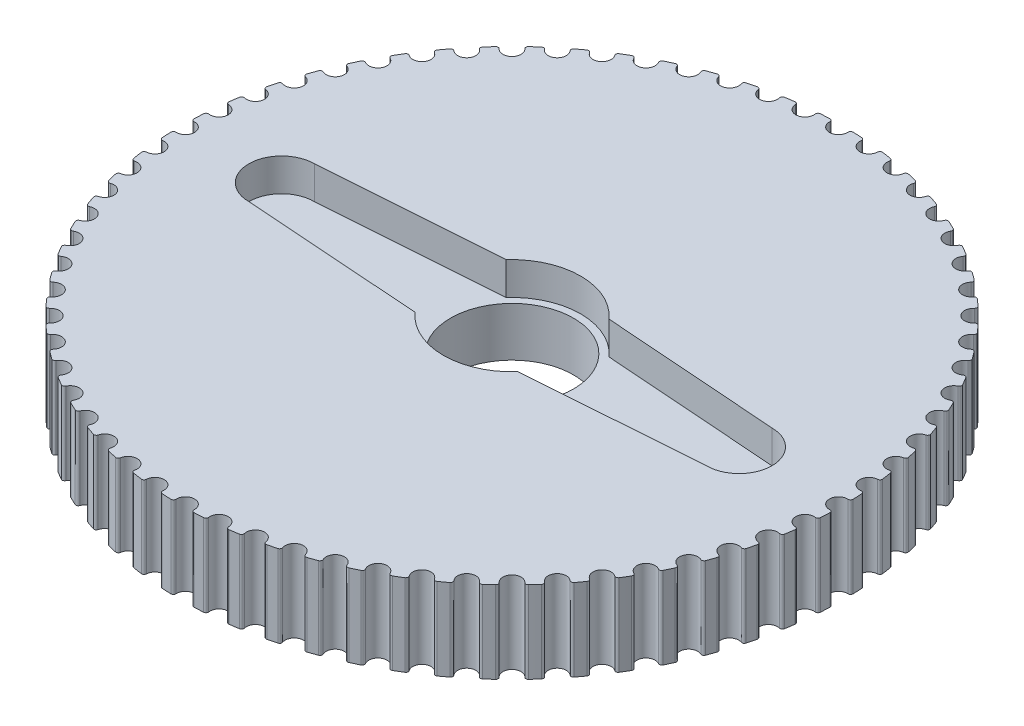
from build123d import *

# Parameters (mm, degrees)
BOSS_EXTRUDE1_DEPTH = 5
CUT_EXTRUDE2_DEPTH  = 2
SKETCH4_R           = 3.75
CUT_EXTRUDE3_DEPTH  = 3


with BuildPart() as part:
    # Sketch1 → Boss-Extrude1 (new body)
    with BuildSketch(Plane(origin=(0, 0, 0), x_dir=(1, 0, 0), z_dir=(0, 1, 0))):
        with BuildLine():
            ThreePointArc((1.264758152, 20.080208834), (0.987241607, 20.095764579), (0.709536651, 20.107485117))
            ThreePointArc((0.709536651, 20.107485117), (0.597601495, 20.063061902), (0.554407106, 19.950646841))
            ThreePointArc((0.554407106, 19.950646841), (0.40140939, 19.54173051), (0, 19.37))
            ThreePointArc((0, 19.37), (-0.40140939, 19.54173051), (-0.554407106, 19.950646841))
            ThreePointArc((-0.554407106, 19.950646841), (-0.597601495, 20.063061902), (-0.709536651, 20.107485117))
            ThreePointArc((-0.709536651, 20.107485117), (-0.987241607, 20.095764579), (-1.264758152, 20.080208834))
            ThreePointArc((-1.264758152, 20.080208834), (-1.371800073, 20.025027964), (-1.403767866, 19.908920422))
            ThreePointArc((-1.403767866, 19.908920422), (-1.515948048, 19.486976737), (-1.898592008, 19.276728156))
            ThreePointArc((-1.898592008, 19.276728156), (-2.314901036, 19.408286736), (-2.507242836, 19.800237624))
            ThreePointArc((-2.507242836, 19.800237624), (-2.561247834, 19.907877585), (-2.676998228, 19.941115327))
            ThreePointArc((-2.676998228, 19.941115327), (-2.952217146, 19.90223138), (-3.226872643, 19.859549163))
            ThreePointArc((-3.226872643, 19.859549163), (-3.327990457, 19.794142061), (-3.348423787, 19.675460217))
            ThreePointArc((-3.348423787, 19.675460217), (-3.418706077, 19.244552725), (-3.778899537, 18.997810881))
            ThreePointArc((-3.778899537, 18.997810881), (-4.206098919, 19.087930551), (-4.435932446, 19.459141295))
            ThreePointArc((-4.435932446, 19.459141295), (-4.500227957, 19.560969525), (-4.61867885, 19.582701695))
            ThreePointArc((-4.61867885, 19.582701695), (-4.88876122, 19.517028814), (-5.157910587, 19.447631177))
            ThreePointArc((-5.157910587, 19.447631177), (-5.252130474, 19.372627749), (-5.260832557, 19.252514574))
            ThreePointArc((-5.260832557, 19.252514574), (-5.288540098, 18.81679315), (-5.622814198, 18.535934303))
            ThreePointArc((-5.622814198, 18.535934303), (-6.05678977, 18.58374716), (-6.321901602, 18.930642798))
            ThreePointArc((-6.321901602, 18.930642798), (-6.395868424, 19.025678635), (-6.515879069, 19.035695941))
            ThreePointArc((-6.515879069, 19.035695941), (-6.77822385, 18.943866591), (-7.039275031, 18.848421871))
            ThreePointArc((-7.039275031, 18.848421871), (-7.125689602, 18.764544442), (-7.122576633, 18.644156691))
            ThreePointArc((-7.122576633, 18.644156691), (-7.107442587, 18.207817571), (-7.412578085, 17.895546545))
            ThreePointArc((-7.412578085, 17.895546545), (-7.849150425, 17.900592125), (-8.146987389, 18.219831862))
            ThreePointArc((-8.146987389, 18.219831862), (-8.229913182, 18.307160059), (-8.35032781, 18.305366029))
            ThreePointArc((-8.35032781, 18.305366029), (-8.60240848, 18.188264578), (-8.85284741, 18.067691959))
            ThreePointArc((-8.85284741, 18.067691959), (-8.930624445, 17.975748314), (-8.915726402, 17.856245387))
            ThreePointArc((-8.915726402, 17.856245387), (-8.857896518, 17.423490756), (-9.130954792, 17.08281489))
            ThreePointArc((-9.130954792, 17.08281489), (-9.565919471, 17.045044603), (-9.893613234, 17.333553985))
            ThreePointArc((-9.893613234, 17.333553985), (-9.984699377, 17.412333524), (-10.10435833, 17.398745436))
            ThreePointArc((-10.10435833, 17.398745436), (-10.343747213, 17.257499633), (-10.581162028, 17.112960297))
            ThreePointArc((-10.581162028, 17.112960297), (-10.649552492, 17.013835903), (-10.623012852, 16.896368679))
            ThreePointArc((-10.623012852, 16.896368679), (-10.523044063, 16.471366199), (-10.761395414, 16.10556639))
            ThreePointArc((-10.761395414, 16.10556639), (-11.190563483, 16.025343983), (-11.544958176, 16.280344508))
            ThreePointArc((-11.544958176, 16.280344508), (-11.643327459, 16.349816699), (-11.761078356, 16.324565412))
            ThreePointArc((-11.761078356, 16.324565412), (-11.985470006, 16.160535533), (-12.207574272, 15.993421473))
            ThreePointArc((-12.207574272, 15.993421473), (-12.265919528, 15.888070952), (-12.227993882, 15.773770704))
            ThreePointArc((-12.227993882, 15.773770704), (-12.086848942, 15.360613382), (-12.288197914, 14.973212482))
            ThreePointArc((-12.288197914, 14.973212482), (-12.707436251, 14.85131054), (-13.085118859, 15.070346414))
            ThreePointArc((-13.085118859, 15.070346414), (-13.189823933, 15.129842201), (-13.304532768, 15.0931709))
            ThreePointArc((-13.304532768, 15.0931709), (-13.511766172, 14.907936642), (-13.716420902, 14.719857256))
            ThreePointArc((-13.716420902, 14.719857256), (-13.764159052, 14.609295192), (-13.715212646, 14.499262694))
            ThreePointArc((-13.715212646, 14.499262694), (-13.534250858, 14.101929462), (-13.696658352, 13.696658352))
            ThreePointArc((-13.696658352, 13.696658352), (-14.101929462, 13.534250858), (-14.499262694, 13.715212646))
            ThreePointArc((-14.499262694, 13.715212646), (-14.609295192, 13.764159052), (-14.719857256, 13.716420902))
            ThreePointArc((-14.719857256, 13.716420902), (-14.907936642, 13.511766172), (-15.0931709, 13.304532768))
            ThreePointArc((-15.0931709, 13.304532768), (-15.129842201, 13.189823933), (-15.070346414, 13.085118859))
            ThreePointArc((-15.070346414, 13.085118859), (-14.85131054, 12.707436251), (-14.973212482, 12.288197914))
            ThreePointArc((-14.973212482, 12.288197914), (-15.360613382, 12.086848942), (-15.773770704, 12.227993882))
            ThreePointArc((-15.773770704, 12.227993882), (-15.888070952, 12.265919528), (-15.993421473, 12.207574272))
            ThreePointArc((-15.993421473, 12.207574272), (-16.160535533, 11.985470006), (-16.324565412, 11.761078356))
            ThreePointArc((-16.324565412, 11.761078356), (-16.349816699, 11.643327459), (-16.280344508, 11.544958176))
            ThreePointArc((-16.280344508, 11.544958176), (-16.025343983, 11.190563483), (-16.10556639, 10.761395414))
            ThreePointArc((-16.10556639, 10.761395414), (-16.471366199, 10.523044063), (-16.896368679, 10.623012852))
            ThreePointArc((-16.896368679, 10.623012852), (-17.013835903, 10.649552492), (-17.112960297, 10.581162028))
            ThreePointArc((-17.112960297, 10.581162028), (-17.257499633, 10.343747213), (-17.398745436, 10.10435833))
            ThreePointArc((-17.398745436, 10.10435833), (-17.412333524, 9.984699377), (-17.333553985, 9.893613234))
            ThreePointArc((-17.333553985, 9.893613234), (-17.045044603, 9.565919471), (-17.08281489, 9.130954792))
            ThreePointArc((-17.08281489, 9.130954792), (-17.423490756, 8.857896518), (-17.856245387, 8.915726402))
            ThreePointArc((-17.856245387, 8.915726402), (-17.975748314, 8.930624445), (-18.067691959, 8.85284741))
            ThreePointArc((-18.067691959, 8.85284741), (-18.188264578, 8.60240848), (-18.305366029, 8.35032781))
            ThreePointArc((-18.305366029, 8.35032781), (-18.307160059, 8.229913182), (-18.219831862, 8.146987389))
            ThreePointArc((-18.219831862, 8.146987389), (-17.900592125, 7.849150425), (-17.895546545, 7.412578085))
            ThreePointArc((-17.895546545, 7.412578085), (-18.207817571, 7.107442587), (-18.644156691, 7.122576633))
            ThreePointArc((-18.644156691, 7.122576633), (-18.764544442, 7.125689602), (-18.848421871, 7.039275031))
            ThreePointArc((-18.848421871, 7.039275031), (-18.943866591, 6.77822385), (-19.035695941, 6.515879069))
            ThreePointArc((-19.035695941, 6.515879069), (-19.025678635, 6.395868424), (-18.930642798, 6.321901602))
            ThreePointArc((-18.930642798, 6.321901602), (-18.58374716, 6.05678977), (-18.535934303, 5.622814198))
            ThreePointArc((-18.535934303, 5.622814198), (-18.81679315, 5.288540098), (-19.252514574, 5.260832557))
            ThreePointArc((-19.252514574, 5.260832557), (-19.372627749, 5.252130474), (-19.447631177, 5.157910587))
            ThreePointArc((-19.447631177, 5.157910587), (-19.517028814, 4.88876122), (-19.582701695, 4.61867885))
            ThreePointArc((-19.582701695, 4.61867885), (-19.560969525, 4.500227957), (-19.459141295, 4.435932446))
            ThreePointArc((-19.459141295, 4.435932446), (-19.087930551, 4.206098919), (-18.997810881, 3.778899537))
            ThreePointArc((-18.997810881, 3.778899537), (-19.244552725, 3.418706077), (-19.675460217, 3.348423787))
            ThreePointArc((-19.675460217, 3.348423787), (-19.794142061, 3.327990457), (-19.859549163, 3.226872643))
            ThreePointArc((-19.859549163, 3.226872643), (-19.90223138, 2.952217146), (-19.941115327, 2.676998228))
            ThreePointArc((-19.941115327, 2.676998228), (-19.907877585, 2.561247834), (-19.800237624, 2.507242836))
            ThreePointArc((-19.800237624, 2.507242836), (-19.408286736, 2.314901036), (-19.276728156, 1.898592008))
            ThreePointArc((-19.276728156, 1.898592008), (-19.486976737, 1.515948048), (-19.908920422, 1.403767866))
            ThreePointArc((-19.908920422, 1.403767866), (-20.025027964, 1.371800073), (-20.080208834, 1.264758152))
            ThreePointArc((-20.080208834, 1.264758152), (-20.095764579, 0.987241607), (-20.107485117, 0.709536651))
            ThreePointArc((-20.107485117, 0.709536651), (-20.063061902, 0.597601495), (-19.950646841, 0.554407106))
            ThreePointArc((-19.950646841, 0.554407106), (-19.54173051, 0.40140939), (-19.37, 0))
            ThreePointArc((-19.37, 0), (-19.54173051, -0.40140939), (-19.950646841, -0.554407106))
            ThreePointArc((-19.950646841, -0.554407106), (-20.063061902, -0.597601495), (-20.107485117, -0.709536651))
            ThreePointArc((-20.107485117, -0.709536651), (-20.095764579, -0.987241607), (-20.080208834, -1.264758152))
            ThreePointArc((-20.080208834, -1.264758152), (-20.025027964, -1.371800073), (-19.908920422, -1.403767866))
            ThreePointArc((-19.908920422, -1.403767866), (-19.486976737, -1.515948048), (-19.276728156, -1.898592008))
            ThreePointArc((-19.276728156, -1.898592008), (-19.408286736, -2.314901036), (-19.800237624, -2.507242836))
            ThreePointArc((-19.800237624, -2.507242836), (-19.907877585, -2.561247834), (-19.941115327, -2.676998228))
            ThreePointArc((-19.941115327, -2.676998228), (-19.90223138, -2.952217146), (-19.859549163, -3.226872643))
            ThreePointArc((-19.859549163, -3.226872643), (-19.794142061, -3.327990457), (-19.675460217, -3.348423787))
            ThreePointArc((-19.675460217, -3.348423787), (-19.244552725, -3.418706077), (-18.997810881, -3.778899537))
            ThreePointArc((-18.997810881, -3.778899537), (-19.087930551, -4.206098919), (-19.459141295, -4.435932446))
            ThreePointArc((-19.459141295, -4.435932446), (-19.560969525, -4.500227957), (-19.582701695, -4.61867885))
            ThreePointArc((-19.582701695, -4.61867885), (-19.517028814, -4.88876122), (-19.447631177, -5.157910587))
            ThreePointArc((-19.447631177, -5.157910587), (-19.372627749, -5.252130474), (-19.252514574, -5.260832557))
            ThreePointArc((-19.252514574, -5.260832557), (-18.81679315, -5.288540098), (-18.535934303, -5.622814198))
            ThreePointArc((-18.535934303, -5.622814198), (-18.58374716, -6.05678977), (-18.930642798, -6.321901602))
            ThreePointArc((-18.930642798, -6.321901602), (-19.025678635, -6.395868424), (-19.035695941, -6.515879069))
            ThreePointArc((-19.035695941, -6.515879069), (-18.943866591, -6.77822385), (-18.848421871, -7.039275031))
            ThreePointArc((-18.848421871, -7.039275031), (-18.764544442, -7.125689602), (-18.644156691, -7.122576633))
            ThreePointArc((-18.644156691, -7.122576633), (-18.207817571, -7.107442587), (-17.895546545, -7.412578085))
            ThreePointArc((-17.895546545, -7.412578085), (-17.900592125, -7.849150425), (-18.219831862, -8.146987389))
            ThreePointArc((-18.219831862, -8.146987389), (-18.307160059, -8.229913182), (-18.305366029, -8.35032781))
            ThreePointArc((-18.305366029, -8.35032781), (-18.188264578, -8.60240848), (-18.067691959, -8.85284741))
            ThreePointArc((-18.067691959, -8.85284741), (-17.975748314, -8.930624445), (-17.856245387, -8.915726402))
            ThreePointArc((-17.856245387, -8.915726402), (-17.423490756, -8.857896518), (-17.08281489, -9.130954792))
            ThreePointArc((-17.08281489, -9.130954792), (-17.045044603, -9.565919471), (-17.333553985, -9.893613234))
            ThreePointArc((-17.333553985, -9.893613234), (-17.412333524, -9.984699377), (-17.398745436, -10.10435833))
            ThreePointArc((-17.398745436, -10.10435833), (-17.257499633, -10.343747213), (-17.112960297, -10.581162028))
            ThreePointArc((-17.112960297, -10.581162028), (-17.013835903, -10.649552492), (-16.896368679, -10.623012852))
            ThreePointArc((-16.896368679, -10.623012852), (-16.471366199, -10.523044063), (-16.10556639, -10.761395414))
            ThreePointArc((-16.10556639, -10.761395414), (-16.025343983, -11.190563483), (-16.280344508, -11.544958176))
            ThreePointArc((-16.280344508, -11.544958176), (-16.349816699, -11.643327459), (-16.324565412, -11.761078356))
            ThreePointArc((-16.324565412, -11.761078356), (-16.160535533, -11.985470006), (-15.993421473, -12.207574272))
            ThreePointArc((-15.993421473, -12.207574272), (-15.888070952, -12.265919528), (-15.773770704, -12.227993882))
            ThreePointArc((-15.773770704, -12.227993882), (-15.360613382, -12.086848942), (-14.973212482, -12.288197914))
            ThreePointArc((-14.973212482, -12.288197914), (-14.85131054, -12.707436251), (-15.070346414, -13.085118859))
            ThreePointArc((-15.070346414, -13.085118859), (-15.129842201, -13.189823933), (-15.0931709, -13.304532768))
            ThreePointArc((-15.0931709, -13.304532768), (-14.907936642, -13.511766172), (-14.719857256, -13.716420902))
            ThreePointArc((-14.719857256, -13.716420902), (-14.609295192, -13.764159052), (-14.499262694, -13.715212646))
            ThreePointArc((-14.499262694, -13.715212646), (-14.101929462, -13.534250858), (-13.696658352, -13.696658352))
            ThreePointArc((-13.696658352, -13.696658352), (-13.534250858, -14.101929462), (-13.715212646, -14.499262694))
            ThreePointArc((-13.715212646, -14.499262694), (-13.764159052, -14.609295192), (-13.716420902, -14.719857256))
            ThreePointArc((-13.716420902, -14.719857256), (-13.511766172, -14.907936642), (-13.304532768, -15.0931709))
            ThreePointArc((-13.304532768, -15.0931709), (-13.189823933, -15.129842201), (-13.085118859, -15.070346414))
            ThreePointArc((-13.085118859, -15.070346414), (-12.707436251, -14.85131054), (-12.288197914, -14.973212482))
            ThreePointArc((-12.288197914, -14.973212482), (-12.086848942, -15.360613382), (-12.227993882, -15.773770704))
            ThreePointArc((-12.227993882, -15.773770704), (-12.265919528, -15.888070952), (-12.207574272, -15.993421473))
            ThreePointArc((-12.207574272, -15.993421473), (-11.985470006, -16.160535533), (-11.761078356, -16.324565412))
            ThreePointArc((-11.761078356, -16.324565412), (-11.643327459, -16.349816699), (-11.544958176, -16.280344508))
            ThreePointArc((-11.544958176, -16.280344508), (-11.190563483, -16.025343983), (-10.761395414, -16.10556639))
            ThreePointArc((-10.761395414, -16.10556639), (-10.523044063, -16.471366199), (-10.623012852, -16.896368679))
            ThreePointArc((-10.623012852, -16.896368679), (-10.649552492, -17.013835903), (-10.581162028, -17.112960297))
            ThreePointArc((-10.581162028, -17.112960297), (-10.343747213, -17.257499633), (-10.10435833, -17.398745436))
            ThreePointArc((-10.10435833, -17.398745436), (-9.984699377, -17.412333524), (-9.893613234, -17.333553985))
            ThreePointArc((-9.893613234, -17.333553985), (-9.565919471, -17.045044603), (-9.130954792, -17.08281489))
            ThreePointArc((-9.130954792, -17.08281489), (-8.857896518, -17.423490756), (-8.915726402, -17.856245387))
            ThreePointArc((-8.915726402, -17.856245387), (-8.930624445, -17.975748314), (-8.85284741, -18.067691959))
            ThreePointArc((-8.85284741, -18.067691959), (-8.60240848, -18.188264578), (-8.35032781, -18.305366029))
            ThreePointArc((-8.35032781, -18.305366029), (-8.229913182, -18.307160059), (-8.146987389, -18.219831862))
            ThreePointArc((-8.146987389, -18.219831862), (-7.849150425, -17.900592125), (-7.412578085, -17.895546545))
            ThreePointArc((-7.412578085, -17.895546545), (-7.107442587, -18.207817571), (-7.122576633, -18.644156691))
            ThreePointArc((-7.122576633, -18.644156691), (-7.125689602, -18.764544442), (-7.039275031, -18.848421871))
            ThreePointArc((-7.039275031, -18.848421871), (-6.77822385, -18.943866591), (-6.515879069, -19.035695941))
            ThreePointArc((-6.515879069, -19.035695941), (-6.395868424, -19.025678635), (-6.321901602, -18.930642798))
            ThreePointArc((-6.321901602, -18.930642798), (-6.05678977, -18.58374716), (-5.622814198, -18.535934303))
            ThreePointArc((-5.622814198, -18.535934303), (-5.288540098, -18.81679315), (-5.260832557, -19.252514574))
            ThreePointArc((-5.260832557, -19.252514574), (-5.252130474, -19.372627749), (-5.157910587, -19.447631177))
            ThreePointArc((-5.157910587, -19.447631177), (-4.88876122, -19.517028814), (-4.61867885, -19.582701695))
            ThreePointArc((-4.61867885, -19.582701695), (-4.500227957, -19.560969525), (-4.435932446, -19.459141295))
            ThreePointArc((-4.435932446, -19.459141295), (-4.206098919, -19.087930551), (-3.778899537, -18.997810881))
            ThreePointArc((-3.778899537, -18.997810881), (-3.418706077, -19.244552725), (-3.348423787, -19.675460217))
            ThreePointArc((-3.348423787, -19.675460217), (-3.327990457, -19.794142061), (-3.226872643, -19.859549163))
            ThreePointArc((-3.226872643, -19.859549163), (-2.952217146, -19.90223138), (-2.676998228, -19.941115327))
            ThreePointArc((-2.676998228, -19.941115327), (-2.561247834, -19.907877585), (-2.507242836, -19.800237624))
            ThreePointArc((-2.507242836, -19.800237624), (-2.314901036, -19.408286736), (-1.898592008, -19.276728156))
            ThreePointArc((-1.898592008, -19.276728156), (-1.515948048, -19.486976737), (-1.403767866, -19.908920422))
            ThreePointArc((-1.403767866, -19.908920422), (-1.371800073, -20.025027964), (-1.264758152, -20.080208834))
            ThreePointArc((-1.264758152, -20.080208834), (-0.987241607, -20.095764579), (-0.709536651, -20.107485117))
            ThreePointArc((-0.709536651, -20.107485117), (-0.597601495, -20.063061902), (-0.554407106, -19.950646841))
            ThreePointArc((-0.554407106, -19.950646841), (-0.40140939, -19.54173051), (0, -19.37))
            ThreePointArc((0, -19.37), (0.40140939, -19.54173051), (0.554407106, -19.950646841))
            ThreePointArc((0.554407106, -19.950646841), (0.597601495, -20.063061902), (0.709536651, -20.107485117))
            ThreePointArc((0.709536651, -20.107485117), (0.987241607, -20.095764579), (1.264758152, -20.080208834))
            ThreePointArc((1.264758152, -20.080208834), (1.371800073, -20.025027964), (1.403767866, -19.908920422))
            ThreePointArc((1.403767866, -19.908920422), (1.515948048, -19.486976737), (1.898592008, -19.276728156))
            ThreePointArc((1.898592008, -19.276728156), (2.314901036, -19.408286736), (2.507242836, -19.800237624))
            ThreePointArc((2.507242836, -19.800237624), (2.561247834, -19.907877585), (2.676998228, -19.941115327))
            ThreePointArc((2.676998228, -19.941115327), (2.952217146, -19.90223138), (3.226872643, -19.859549163))
            ThreePointArc((3.226872643, -19.859549163), (3.327990457, -19.794142061), (3.348423787, -19.675460217))
            ThreePointArc((3.348423787, -19.675460217), (3.418706077, -19.244552725), (3.778899537, -18.997810881))
            ThreePointArc((3.778899537, -18.997810881), (4.206098919, -19.087930551), (4.435932446, -19.459141295))
            ThreePointArc((4.435932446, -19.459141295), (4.500227957, -19.560969525), (4.61867885, -19.582701695))
            ThreePointArc((4.61867885, -19.582701695), (4.88876122, -19.517028814), (5.157910587, -19.447631177))
            ThreePointArc((5.157910587, -19.447631177), (5.252130474, -19.372627749), (5.260832557, -19.252514574))
            ThreePointArc((5.260832557, -19.252514574), (5.288540098, -18.81679315), (5.622814198, -18.535934303))
            ThreePointArc((5.622814198, -18.535934303), (6.05678977, -18.58374716), (6.321901602, -18.930642798))
            ThreePointArc((6.321901602, -18.930642798), (6.395868424, -19.025678635), (6.515879069, -19.035695941))
            ThreePointArc((6.515879069, -19.035695941), (6.77822385, -18.943866591), (7.039275031, -18.848421871))
            ThreePointArc((7.039275031, -18.848421871), (7.125689602, -18.764544442), (7.122576633, -18.644156691))
            ThreePointArc((7.122576633, -18.644156691), (7.107442587, -18.207817571), (7.412578085, -17.895546545))
            ThreePointArc((7.412578085, -17.895546545), (7.849150425, -17.900592125), (8.146987389, -18.219831862))
            ThreePointArc((8.146987389, -18.219831862), (8.229913182, -18.307160059), (8.35032781, -18.305366029))
            ThreePointArc((8.35032781, -18.305366029), (8.60240848, -18.188264578), (8.85284741, -18.067691959))
            ThreePointArc((8.85284741, -18.067691959), (8.930624445, -17.975748314), (8.915726402, -17.856245387))
            ThreePointArc((8.915726402, -17.856245387), (8.857896518, -17.423490756), (9.130954792, -17.08281489))
            ThreePointArc((9.130954792, -17.08281489), (9.565919471, -17.045044603), (9.893613234, -17.333553985))
            ThreePointArc((9.893613234, -17.333553985), (9.984699377, -17.412333524), (10.10435833, -17.398745436))
            ThreePointArc((10.10435833, -17.398745436), (10.343747213, -17.257499633), (10.581162028, -17.112960297))
            ThreePointArc((10.581162028, -17.112960297), (10.649552492, -17.013835903), (10.623012852, -16.896368679))
            ThreePointArc((10.623012852, -16.896368679), (10.523044063, -16.471366199), (10.761395414, -16.10556639))
            ThreePointArc((10.761395414, -16.10556639), (11.190563483, -16.025343983), (11.544958176, -16.280344508))
            ThreePointArc((11.544958176, -16.280344508), (11.643327459, -16.349816699), (11.761078356, -16.324565412))
            ThreePointArc((11.761078356, -16.324565412), (11.985470006, -16.160535533), (12.207574272, -15.993421473))
            ThreePointArc((12.207574272, -15.993421473), (12.265919528, -15.888070952), (12.227993882, -15.773770704))
            ThreePointArc((12.227993882, -15.773770704), (12.086848942, -15.360613382), (12.288197914, -14.973212482))
            ThreePointArc((12.288197914, -14.973212482), (12.707436251, -14.85131054), (13.085118859, -15.070346414))
            ThreePointArc((13.085118859, -15.070346414), (13.189823933, -15.129842201), (13.304532768, -15.0931709))
            ThreePointArc((13.304532768, -15.0931709), (13.511766172, -14.907936642), (13.716420902, -14.719857256))
            ThreePointArc((13.716420902, -14.719857256), (13.764159052, -14.609295192), (13.715212646, -14.499262694))
            ThreePointArc((13.715212646, -14.499262694), (13.534250858, -14.101929462), (13.696658352, -13.696658352))
            ThreePointArc((13.696658352, -13.696658352), (14.101929462, -13.534250858), (14.499262694, -13.715212646))
            ThreePointArc((14.499262694, -13.715212646), (14.609295192, -13.764159052), (14.719857256, -13.716420902))
            ThreePointArc((14.719857256, -13.716420902), (14.907936642, -13.511766172), (15.0931709, -13.304532768))
            ThreePointArc((15.0931709, -13.304532768), (15.129842201, -13.189823933), (15.070346414, -13.085118859))
            ThreePointArc((15.070346414, -13.085118859), (14.85131054, -12.707436251), (14.973212482, -12.288197914))
            ThreePointArc((14.973212482, -12.288197914), (15.360613382, -12.086848942), (15.773770704, -12.227993882))
            ThreePointArc((15.773770704, -12.227993882), (15.888070952, -12.265919528), (15.993421473, -12.207574272))
            ThreePointArc((15.993421473, -12.207574272), (16.160535533, -11.985470006), (16.324565412, -11.761078356))
            ThreePointArc((16.324565412, -11.761078356), (16.349816699, -11.643327459), (16.280344508, -11.544958176))
            ThreePointArc((16.280344508, -11.544958176), (16.025343983, -11.190563483), (16.10556639, -10.761395414))
            ThreePointArc((16.10556639, -10.761395414), (16.471366199, -10.523044063), (16.896368679, -10.623012852))
            ThreePointArc((16.896368679, -10.623012852), (17.013835903, -10.649552492), (17.112960297, -10.581162028))
            ThreePointArc((17.112960297, -10.581162028), (17.257499633, -10.343747213), (17.398745436, -10.10435833))
            ThreePointArc((17.398745436, -10.10435833), (17.412333524, -9.984699377), (17.333553985, -9.893613234))
            ThreePointArc((17.333553985, -9.893613234), (17.045044603, -9.565919471), (17.08281489, -9.130954792))
            ThreePointArc((17.08281489, -9.130954792), (17.423490756, -8.857896518), (17.856245387, -8.915726402))
            ThreePointArc((17.856245387, -8.915726402), (17.975748314, -8.930624445), (18.067691959, -8.85284741))
            ThreePointArc((18.067691959, -8.85284741), (18.188264578, -8.60240848), (18.305366029, -8.35032781))
            ThreePointArc((18.305366029, -8.35032781), (18.307160059, -8.229913182), (18.219831862, -8.146987389))
            ThreePointArc((18.219831862, -8.146987389), (17.900592125, -7.849150425), (17.895546545, -7.412578085))
            ThreePointArc((17.895546545, -7.412578085), (18.207817571, -7.107442587), (18.644156691, -7.122576633))
            ThreePointArc((18.644156691, -7.122576633), (18.764544442, -7.125689602), (18.848421871, -7.039275031))
            ThreePointArc((18.848421871, -7.039275031), (18.943866591, -6.77822385), (19.035695941, -6.515879069))
            ThreePointArc((19.035695941, -6.515879069), (19.025678635, -6.395868424), (18.930642798, -6.321901602))
            ThreePointArc((18.930642798, -6.321901602), (18.58374716, -6.05678977), (18.535934303, -5.622814198))
            ThreePointArc((18.535934303, -5.622814198), (18.81679315, -5.288540098), (19.252514574, -5.260832557))
            ThreePointArc((19.252514574, -5.260832557), (19.372627749, -5.252130474), (19.447631177, -5.157910587))
            ThreePointArc((19.447631177, -5.157910587), (19.517028814, -4.88876122), (19.582701695, -4.61867885))
            ThreePointArc((19.582701695, -4.61867885), (19.560969525, -4.500227957), (19.459141295, -4.435932446))
            ThreePointArc((19.459141295, -4.435932446), (19.087930551, -4.206098919), (18.997810881, -3.778899537))
            ThreePointArc((18.997810881, -3.778899537), (19.244552725, -3.418706077), (19.675460217, -3.348423787))
            ThreePointArc((19.675460217, -3.348423787), (19.794142061, -3.327990457), (19.859549163, -3.226872643))
            ThreePointArc((19.859549163, -3.226872643), (19.90223138, -2.952217146), (19.941115327, -2.676998228))
            ThreePointArc((19.941115327, -2.676998228), (19.907877585, -2.561247834), (19.800237624, -2.507242836))
            ThreePointArc((19.800237624, -2.507242836), (19.408286736, -2.314901036), (19.276728156, -1.898592008))
            ThreePointArc((19.276728156, -1.898592008), (19.486976737, -1.515948048), (19.908920422, -1.403767866))
            ThreePointArc((19.908920422, -1.403767866), (20.025027964, -1.371800073), (20.080208834, -1.264758152))
            ThreePointArc((20.080208834, -1.264758152), (20.095764579, -0.987241607), (20.107485117, -0.709536651))
            ThreePointArc((20.107485117, -0.709536651), (20.063061902, -0.597601495), (19.950646841, -0.554407106))
            ThreePointArc((19.950646841, -0.554407106), (19.54173051, -0.40140939), (19.37, 0))
            ThreePointArc((19.37, 0), (19.54173051, 0.40140939), (19.950646841, 0.554407106))
            ThreePointArc((19.950646841, 0.554407106), (20.063061902, 0.597601495), (20.107485117, 0.709536651))
            ThreePointArc((20.107485117, 0.709536651), (20.095764579, 0.987241607), (20.080208834, 1.264758152))
            ThreePointArc((20.080208834, 1.264758152), (20.025027964, 1.371800073), (19.908920422, 1.403767866))
            ThreePointArc((19.908920422, 1.403767866), (19.486976737, 1.515948048), (19.276728156, 1.898592008))
            ThreePointArc((19.276728156, 1.898592008), (19.408286736, 2.314901036), (19.800237624, 2.507242836))
            ThreePointArc((19.800237624, 2.507242836), (19.907877585, 2.561247834), (19.941115327, 2.676998228))
            ThreePointArc((19.941115327, 2.676998228), (19.90223138, 2.952217146), (19.859549163, 3.226872643))
            ThreePointArc((19.859549163, 3.226872643), (19.794142061, 3.327990457), (19.675460217, 3.348423787))
            ThreePointArc((19.675460217, 3.348423787), (19.244552725, 3.418706077), (18.997810881, 3.778899537))
            ThreePointArc((18.997810881, 3.778899537), (19.087930551, 4.206098919), (19.459141295, 4.435932446))
            ThreePointArc((19.459141295, 4.435932446), (19.560969525, 4.500227957), (19.582701695, 4.61867885))
            ThreePointArc((19.582701695, 4.61867885), (19.517028814, 4.88876122), (19.447631177, 5.157910587))
            ThreePointArc((19.447631177, 5.157910587), (19.372627749, 5.252130474), (19.252514574, 5.260832557))
            ThreePointArc((19.252514574, 5.260832557), (18.81679315, 5.288540098), (18.535934303, 5.622814198))
            ThreePointArc((18.535934303, 5.622814198), (18.58374716, 6.05678977), (18.930642798, 6.321901602))
            ThreePointArc((18.930642798, 6.321901602), (19.025678635, 6.395868424), (19.035695941, 6.515879069))
            ThreePointArc((19.035695941, 6.515879069), (18.943866591, 6.77822385), (18.848421871, 7.039275031))
            ThreePointArc((18.848421871, 7.039275031), (18.764544442, 7.125689602), (18.644156691, 7.122576633))
            ThreePointArc((18.644156691, 7.122576633), (18.207817571, 7.107442587), (17.895546545, 7.412578085))
            ThreePointArc((17.895546545, 7.412578085), (17.900592125, 7.849150425), (18.219831862, 8.146987389))
            ThreePointArc((18.219831862, 8.146987389), (18.307160059, 8.229913182), (18.305366029, 8.35032781))
            ThreePointArc((18.305366029, 8.35032781), (18.188264578, 8.60240848), (18.067691959, 8.85284741))
            ThreePointArc((18.067691959, 8.85284741), (17.975748314, 8.930624445), (17.856245387, 8.915726402))
            ThreePointArc((17.856245387, 8.915726402), (17.423490756, 8.857896518), (17.08281489, 9.130954792))
            ThreePointArc((17.08281489, 9.130954792), (17.045044603, 9.565919471), (17.333553985, 9.893613234))
            ThreePointArc((17.333553985, 9.893613234), (17.412333524, 9.984699377), (17.398745436, 10.10435833))
            ThreePointArc((17.398745436, 10.10435833), (17.257499633, 10.343747213), (17.112960297, 10.581162028))
            ThreePointArc((17.112960297, 10.581162028), (17.013835903, 10.649552492), (16.896368679, 10.623012852))
            ThreePointArc((16.896368679, 10.623012852), (16.471366199, 10.523044063), (16.10556639, 10.761395414))
            ThreePointArc((16.10556639, 10.761395414), (16.025343983, 11.190563483), (16.280344508, 11.544958176))
            ThreePointArc((16.280344508, 11.544958176), (16.349816699, 11.643327459), (16.324565412, 11.761078356))
            ThreePointArc((16.324565412, 11.761078356), (16.160535533, 11.985470006), (15.993421473, 12.207574272))
            ThreePointArc((15.993421473, 12.207574272), (15.888070952, 12.265919528), (15.773770704, 12.227993882))
            ThreePointArc((15.773770704, 12.227993882), (15.360613382, 12.086848942), (14.973212482, 12.288197914))
            ThreePointArc((14.973212482, 12.288197914), (14.85131054, 12.707436251), (15.070346414, 13.085118859))
            ThreePointArc((15.070346414, 13.085118859), (15.129842201, 13.189823933), (15.0931709, 13.304532768))
            ThreePointArc((15.0931709, 13.304532768), (14.907936642, 13.511766172), (14.719857256, 13.716420902))
            ThreePointArc((14.719857256, 13.716420902), (14.609295192, 13.764159052), (14.499262694, 13.715212646))
            ThreePointArc((14.499262694, 13.715212646), (14.101929462, 13.534250858), (13.696658352, 13.696658352))
            ThreePointArc((13.696658352, 13.696658352), (13.534250858, 14.101929462), (13.715212646, 14.499262694))
            ThreePointArc((13.715212646, 14.499262694), (13.764159052, 14.609295192), (13.716420902, 14.719857256))
            ThreePointArc((13.716420902, 14.719857256), (13.511766172, 14.907936642), (13.304532768, 15.0931709))
            ThreePointArc((13.304532768, 15.0931709), (13.189823933, 15.129842201), (13.085118859, 15.070346414))
            ThreePointArc((13.085118859, 15.070346414), (12.707436251, 14.85131054), (12.288197914, 14.973212482))
            ThreePointArc((12.288197914, 14.973212482), (12.086848942, 15.360613382), (12.227993882, 15.773770704))
            ThreePointArc((12.227993882, 15.773770704), (12.265919528, 15.888070952), (12.207574272, 15.993421473))
            ThreePointArc((12.207574272, 15.993421473), (11.985470006, 16.160535533), (11.761078356, 16.324565412))
            ThreePointArc((11.761078356, 16.324565412), (11.643327459, 16.349816699), (11.544958176, 16.280344508))
            ThreePointArc((11.544958176, 16.280344508), (11.190563483, 16.025343983), (10.761395414, 16.10556639))
            ThreePointArc((10.761395414, 16.10556639), (10.523044063, 16.471366199), (10.623012852, 16.896368679))
            ThreePointArc((10.623012852, 16.896368679), (10.649552492, 17.013835903), (10.581162028, 17.112960297))
            ThreePointArc((10.581162028, 17.112960297), (10.343747213, 17.257499633), (10.10435833, 17.398745436))
            ThreePointArc((10.10435833, 17.398745436), (9.984699377, 17.412333524), (9.893613234, 17.333553985))
            ThreePointArc((9.893613234, 17.333553985), (9.565919471, 17.045044603), (9.130954792, 17.08281489))
            ThreePointArc((9.130954792, 17.08281489), (8.857896518, 17.423490756), (8.915726402, 17.856245387))
            ThreePointArc((8.915726402, 17.856245387), (8.930624445, 17.975748314), (8.85284741, 18.067691959))
            ThreePointArc((8.85284741, 18.067691959), (8.60240848, 18.188264578), (8.35032781, 18.305366029))
            ThreePointArc((8.35032781, 18.305366029), (8.229913182, 18.307160059), (8.146987389, 18.219831862))
            ThreePointArc((8.146987389, 18.219831862), (7.849150425, 17.900592125), (7.412578085, 17.895546545))
            ThreePointArc((7.412578085, 17.895546545), (7.107442587, 18.207817571), (7.122576633, 18.644156691))
            ThreePointArc((7.122576633, 18.644156691), (7.125689602, 18.764544442), (7.039275031, 18.848421871))
            ThreePointArc((7.039275031, 18.848421871), (6.77822385, 18.943866591), (6.515879069, 19.035695941))
            ThreePointArc((6.515879069, 19.035695941), (6.395868424, 19.025678635), (6.321901602, 18.930642798))
            ThreePointArc((6.321901602, 18.930642798), (6.05678977, 18.58374716), (5.622814198, 18.535934303))
            ThreePointArc((5.622814198, 18.535934303), (5.288540098, 18.81679315), (5.260832557, 19.252514574))
            ThreePointArc((5.260832557, 19.252514574), (5.252130474, 19.372627749), (5.157910587, 19.447631177))
            ThreePointArc((5.157910587, 19.447631177), (4.88876122, 19.517028814), (4.61867885, 19.582701695))
            ThreePointArc((4.61867885, 19.582701695), (4.500227957, 19.560969525), (4.435932446, 19.459141295))
            ThreePointArc((4.435932446, 19.459141295), (4.206098919, 19.087930551), (3.778899537, 18.997810881))
            ThreePointArc((3.778899537, 18.997810881), (3.418706077, 19.244552725), (3.348423787, 19.675460217))
            ThreePointArc((3.348423787, 19.675460217), (3.327990457, 19.794142061), (3.226872643, 19.859549163))
            ThreePointArc((3.226872643, 19.859549163), (2.952217146, 19.90223138), (2.676998228, 19.941115327))
            ThreePointArc((2.676998228, 19.941115327), (2.561247834, 19.907877585), (2.507242836, 19.800237624))
            ThreePointArc((2.507242836, 19.800237624), (2.314901036, 19.408286736), (1.898592008, 19.276728156))
            ThreePointArc((1.898592008, 19.276728156), (1.515948048, 19.486976737), (1.403767866, 19.908920422))
            ThreePointArc((1.403767866, 19.908920422), (1.371800073, 20.025027964), (1.264758152, 20.080208834))
        make_face()
    extrude(amount=BOSS_EXTRUDE1_DEPTH)

    # Sketch2 → Cut-Extrude2 (cut)
    with BuildSketch(Plane(origin=(0, 5, 0), x_dir=(1, 0, 0), z_dir=(0, 1, 0))):
        with BuildLine():
            Line((-3.141265312, -2.775594211), (-14.058542875, -2))
            ThreePointArc((-14.058542875, -2), (-16.058542875, 0), (-14.058542875, 2))
            Line((-14.058542875, 2), (-3.136113737, 2.7814136))
            ThreePointArc((-3.136113737, 2.7814136), (0, 4.191833845), (3.136113737, 2.7814136))
            Line((3.136113737, 2.7814136), (13.862414246, 2))
            ThreePointArc((13.862414246, 2), (15.862414246, 0), (13.862414246, -2))
            Line((13.862414246, -2), (3.141289797, -2.7755665))
            ThreePointArc((3.141289797, -2.7755665), (1.8489e-05, -4.191833845), (-3.141265312, -2.775594211))
        make_face()
    extrude(amount=-CUT_EXTRUDE2_DEPTH, mode=Mode.SUBTRACT)

    # Sketch4 → Cut-Extrude3 (cut)
    with BuildSketch(Plane(origin=(0, 3, 0), x_dir=(1, 0, 0), z_dir=(0, 1, 0))):
        Circle(SKETCH4_R)
    extrude(amount=-CUT_EXTRUDE3_DEPTH, mode=Mode.SUBTRACT)


solid = part.part
